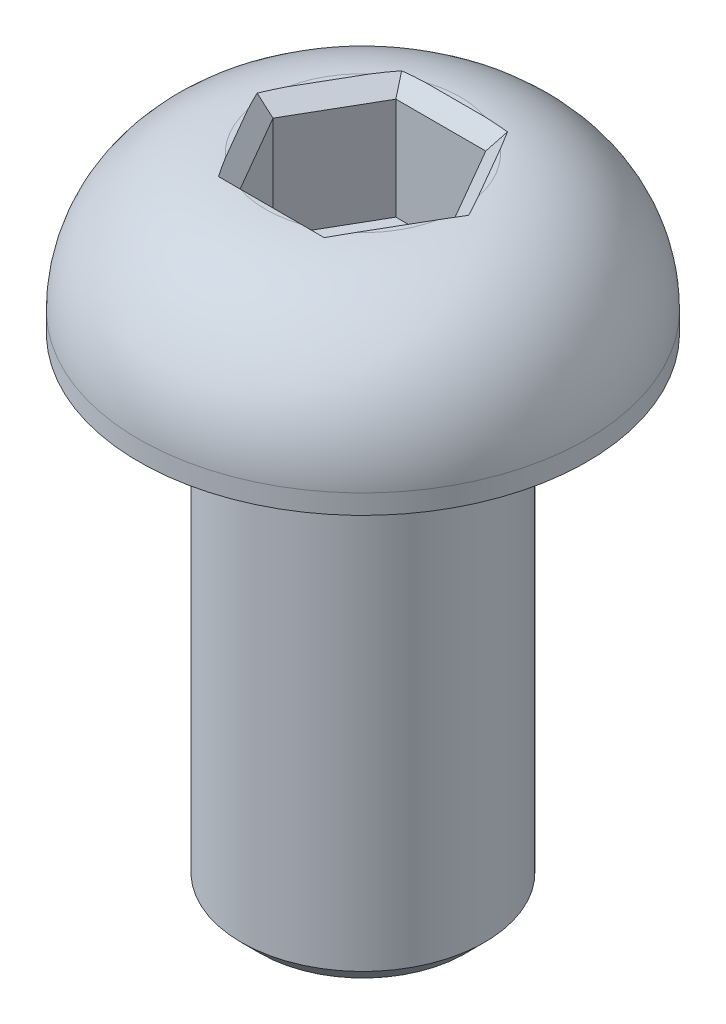
from build123d import *

# Parameters (mm, degrees)
EXTRUDE1_DEPTH = 3.0477
CHAMFER1_SIZE  = 0.381
CHAMFER2_SIZE  = 0.381
CHAMFER3_SIZE  = 0.508


with BuildPart() as part:
    # Sketch1 → Revolve1 (revolve)
    with BuildSketch(Plane.XY, mode=Mode.PRIVATE) as revolve1_sk:
        with BuildLine():
            Line((0, 16.754916971), (-2.54, 16.754916971))
            ThreePointArc((-2.54, 16.754916971), (-4.888725495, 15.631005572), (-5.842, 13.208))
            Line((-5.842, 13.208), (-5.842, 12.7))
            Line((-5.842, 12.7), (-3.175, 12.7))
            Line((-3.175, 12.7), (-3.175, 0))
            Line((-3.175, 0), (0, 0))
            Line((0, 0), (0, 16.754916971))
        make_face()
    revolve(revolve1_sk.sketch.rotate(Axis((0, 0, 0), (0, 1, 0)), 270), axis=Axis((0, 0, 0), (0, 1, 0)))

    # Sketch2 → Extrude1 (cut)
    with BuildSketch(Plane(origin=(0, 16.754916971, 0), x_dir=(1, 0, 0), z_dir=(0, 1, 0))):
        Polygon((1.173175747, -2.032), (2.346351494, 0), (1.173175747, 2.032), (-1.173175747, 2.032), (-2.346351494, 0), (-1.173175747, -2.032), align=None)
    extrude(amount=-EXTRUDE1_DEPTH, mode=Mode.SUBTRACT)

    # Chamfer1
    # the kernel refuses this chamfer: 0.381 mm, written as the material it takes off along each edge
    with BuildSketch(Plane(origin=(2.836257103, 16.754916971, 0.848541406), x_dir=(0.8656979742248802, 0.02749587661058275, -0.4998109584556487), z_dir=(-0.5000000000000003, 0, -0.8660254037844386))) as chamfer1_piece_1_section:
        Polygon((CHAMFER1_SIZE * 0.999621916911, CHAMFER1_SIZE * 0.0274958766106), (-CHAMFER1_SIZE * 0.0274958766106, CHAMFER1_SIZE * 0.999621916911), (0, 0), align=None)
    chamfer1_piece_1 = extrude(amount=4.305973931, mode=Mode.PRIVATE)
    chamfer1_piece_1 = split(chamfer1_piece_1, bisect_by=Plane(origin=(1.86439326, 16.626680536, -2.032), z_dir=(0, 0, 1)), keep=Keep.TOP, mode=Mode.PRIVATE)
    chamfer1_piece_1 = split(chamfer1_piece_1, bisect_by=Plane(origin=(2.691960251, 16.626680536, -0.598611926), z_dir=(-0.8660254037844386, 0, -0.5000000000000002)), keep=Keep.TOP, mode=Mode.PRIVATE)
    add(chamfer1_piece_1, mode=Mode.SUBTRACT)
    with BuildSketch(Plane(origin=(2.152986965, 16.754916971, -2.032), x_dir=(0, 0.027495876610582747, -0.9996219169112968), z_dir=(-1, 0, 0))) as chamfer1_piece_2_section:
        Polygon((CHAMFER1_SIZE * 0.999621916911, CHAMFER1_SIZE * 0.0274958766106), (-CHAMFER1_SIZE * 0.0274958766106, CHAMFER1_SIZE * 0.999621916911), (0, 0), align=None)
    chamfer1_piece_2 = extrude(amount=4.305973931, mode=Mode.PRIVATE)
    chamfer1_piece_2 = split(chamfer1_piece_2, bisect_by=Plane(origin=(-0.82756699, 16.626680536, -2.630611926), z_dir=(0.8660254037844386, 0, 0.5000000000000001)), keep=Keep.TOP, mode=Mode.PRIVATE)
    chamfer1_piece_2 = split(chamfer1_piece_2, bisect_by=Plane(origin=(0.82756699, 16.626680536, -2.630611926), z_dir=(-0.8660254037844387, 0, 0.5000000000000003)), keep=Keep.TOP, mode=Mode.PRIVATE)
    add(chamfer1_piece_2, mode=Mode.SUBTRACT)
    with BuildSketch(Plane(origin=(-0.683270138, 16.754916971, -2.880541406), x_dir=(-0.8656979742248804, 0.02749587661058275, -0.4998109584556485), z_dir=(-0.5000000000000001, 0, 0.8660254037844386))) as chamfer1_piece_3_section:
        Polygon((CHAMFER1_SIZE * 0.999621916911, CHAMFER1_SIZE * 0.0274958766106), (-CHAMFER1_SIZE * 0.0274958766106, CHAMFER1_SIZE * 0.999621916911), (0, 0), align=None)
    chamfer1_piece_3 = extrude(amount=4.305973931, mode=Mode.PRIVATE)
    chamfer1_piece_3 = split(chamfer1_piece_3, bisect_by=Plane(origin=(-2.691960251, 16.626680536, -0.598611926), z_dir=(0.8660254037844387, 0, -0.5000000000000001)), keep=Keep.TOP, mode=Mode.PRIVATE)
    chamfer1_piece_3 = split(chamfer1_piece_3, bisect_by=Plane(origin=(-1.86439326, 16.626680536, -2.032), z_dir=(0, 0, 1)), keep=Keep.TOP, mode=Mode.PRIVATE)
    add(chamfer1_piece_3, mode=Mode.SUBTRACT)
    with BuildSketch(Plane(origin=(2.152986965, 16.754916971, -2.032), x_dir=(0, 0.027495876610582747, -0.9996219169112968), z_dir=(-1, 0, 0))) as chamfer1_piece_4a_section:
        Polygon((CHAMFER1_SIZE * 0.999621916911, CHAMFER1_SIZE * 0.0274958766106), (-CHAMFER1_SIZE * 0.0274958766106, CHAMFER1_SIZE * 0.999621916911), (0, 0), align=None)
    chamfer1_piece_4a = extrude(amount=4.305973931, mode=Mode.PRIVATE)
    chamfer1_piece_4a = split(chamfer1_piece_4a, bisect_by=Plane(origin=(1.229620554, 16.631969248, -1.934234726), z_dir=(0.8660254037844387, 0, -0.5000000000000003)), keep=Keep.TOP, mode=Mode.PRIVATE)
    with BuildSketch(Plane(origin=(2.836257103, 16.754916971, 0.848541406), x_dir=(0.8656979742248802, 0.02749587661058275, -0.4998109584556487), z_dir=(-0.5000000000000003, 0, -0.8660254037844386))) as chamfer1_piece_4b_section:
        Polygon((CHAMFER1_SIZE * 0.999621916911, CHAMFER1_SIZE * 0.0274958766106), (-CHAMFER1_SIZE * 0.0274958766106, CHAMFER1_SIZE * 0.999621916911), (0, 0), align=None)
    chamfer1_piece_4b = extrude(amount=4.305973931, mode=Mode.PRIVATE)
    chamfer1_piece_4b = split(chamfer1_piece_4b, bisect_by=Plane(origin=(1.060286133, 16.631969248, -2.032), z_dir=(0, 0, -1)), keep=Keep.TOP, mode=Mode.PRIVATE)
    chamfer1_piece_4 = chamfer1_piece_4a & chamfer1_piece_4b
    add(chamfer1_piece_4, mode=Mode.SUBTRACT)
    with BuildSketch(Plane(origin=(-0.683270138, 16.754916971, -2.880541406), x_dir=(-0.8656979742248804, 0.02749587661058275, -0.4998109584556485), z_dir=(-0.5000000000000001, 0, 0.8660254037844386))) as chamfer1_piece_5a_section:
        Polygon((CHAMFER1_SIZE * 0.999621916911, CHAMFER1_SIZE * 0.0274958766106), (-CHAMFER1_SIZE * 0.0274958766106, CHAMFER1_SIZE * 0.999621916911), (0, 0), align=None)
    chamfer1_piece_5a = extrude(amount=4.305973931, mode=Mode.PRIVATE)
    chamfer1_piece_5a = split(chamfer1_piece_5a, bisect_by=Plane(origin=(-1.060286133, 16.631969248, -2.032), z_dir=(0, 0, -1)), keep=Keep.TOP, mode=Mode.PRIVATE)
    with BuildSketch(Plane(origin=(2.152986965, 16.754916971, -2.032), x_dir=(0, 0.027495876610582747, -0.9996219169112968), z_dir=(-1, 0, 0))) as chamfer1_piece_5b_section:
        Polygon((CHAMFER1_SIZE * 0.999621916911, CHAMFER1_SIZE * 0.0274958766106), (-CHAMFER1_SIZE * 0.0274958766106, CHAMFER1_SIZE * 0.999621916911), (0, 0), align=None)
    chamfer1_piece_5b = extrude(amount=4.305973931, mode=Mode.PRIVATE)
    chamfer1_piece_5b = split(chamfer1_piece_5b, bisect_by=Plane(origin=(-1.229620554, 16.631969248, -1.934234726), z_dir=(-0.8660254037844386, 0, -0.5000000000000001)), keep=Keep.TOP, mode=Mode.PRIVATE)
    chamfer1_piece_5 = chamfer1_piece_5a & chamfer1_piece_5b
    add(chamfer1_piece_5, mode=Mode.SUBTRACT)

    # Chamfer2
    # the kernel refuses this chamfer: 0.381 mm, written as the material it takes off along each edge
    with BuildSketch(Plane(origin=(3.01166923, 16.754916971, -1.152364121), x_dir=(-0.02381212764409397, -0.9996219169112966, -0.013747938305285933), z_dir=(-0.4999999999999081, 5.2687907827436646e-15, 0.8660254037844918))) as chamfer2_piece_1_section:
        Polygon((CHAMFER2_SIZE * 0.999621916911, CHAMFER2_SIZE * 0.0274958766106), (-CHAMFER2_SIZE * 0.0274958766106, CHAMFER2_SIZE * 0.999621916911), (0, 0), align=None)
    chamfer2_piece_1 = extrude(amount=4.656798184, mode=Mode.PRIVATE)
    chamfer2_piece_1 = split(chamfer2_piece_1, bisect_by=Plane(origin=(2.577265725, 16.592496514, -0.037203907), z_dir=(-0.6123724356959522, 0.7071067811862759, 0.35355339059354396)), keep=Keep.TOP, mode=Mode.PRIVATE)
    chamfer2_piece_1 = split(chamfer2_piece_1, bisect_by=Plane(origin=(2.387970288, 16.665356362, 0.072085865), z_dir=(0.8660254037844386, 0, -0.5000000000000003)), keep=Keep.TOP, mode=Mode.PRIVATE)
    add(chamfer2_piece_1, mode=Mode.SUBTRACT)
    with BuildSketch(Plane(origin=(3.01166923, 16.754916971, -1.152364121), x_dir=(-0.02381212764409397, -0.9996219169112966, -0.013747938305285933), z_dir=(-0.4999999999999081, 5.2687907827436646e-15, 0.8660254037844918))) as chamfer2_piece_2_section:
        Polygon((CHAMFER2_SIZE * 0.999621916911, CHAMFER2_SIZE * 0.0274958766106), (-CHAMFER2_SIZE * 0.0274958766106, CHAMFER2_SIZE * 0.999621916911), (0, 0), align=None)
    chamfer2_piece_2 = extrude(amount=4.656798184, mode=Mode.PRIVATE)
    chamfer2_piece_2 = split(chamfer2_piece_2, bisect_by=Plane(origin=(2.691961715, 16.626681616, 0.598614463), z_dir=(-0.8660254037844386, 0, 0.5000000000000003)), keep=Keep.TOP, mode=Mode.PRIVATE)
    chamfer2_piece_2 = split(chamfer2_piece_2, bisect_by=Plane(origin=(1.864391291, 16.626681616, 2.032), z_dir=(0, 0, -1)), keep=Keep.TOP, mode=Mode.PRIVATE)
    add(chamfer2_piece_2, mode=Mode.SUBTRACT)
    with BuildSketch(Plane(origin=(-2.152986965, 16.754916971, 2.032), x_dir=(0, 0.027495876610582747, 0.9996219169112968), z_dir=(1, 0, 0))) as chamfer2_piece_3_section:
        Polygon((CHAMFER2_SIZE * 0.999621916911, CHAMFER2_SIZE * 0.0274958766106), (-CHAMFER2_SIZE * 0.0274958766106, CHAMFER2_SIZE * 0.999621916911), (0, 0), align=None)
    chamfer2_piece_3 = extrude(amount=4.305973931, mode=Mode.PRIVATE)
    chamfer2_piece_3 = split(chamfer2_piece_3, bisect_by=Plane(origin=(0.82756699, 16.626680536, 2.630611926), z_dir=(-0.866025403784329, 0, -0.50000000000019)), keep=Keep.TOP, mode=Mode.PRIVATE)
    chamfer2_piece_3 = split(chamfer2_piece_3, bisect_by=Plane(origin=(-0.82756699, 16.626680536, 2.630611926), z_dir=(0.866025403784329, 0, -0.50000000000019)), keep=Keep.TOP, mode=Mode.PRIVATE)
    add(chamfer2_piece_3, mode=Mode.SUBTRACT)
    with BuildSketch(Plane(origin=(-0.683270138, 16.754916971, 2.880541406), x_dir=(-0.8656979742249333, 0.02749587661058274, 0.4998109584555566), z_dir=(-0.49999999999990835, -5.268790782743671e-15, -0.8660254037844917))) as chamfer2_piece_4_section:
        Polygon((CHAMFER2_SIZE * 0.999621916911, -CHAMFER2_SIZE * 0.0274958766106), (-CHAMFER2_SIZE * 0.0274958766106, -CHAMFER2_SIZE * 0.999621916911), (0, 0), align=None)
    chamfer2_piece_4 = extrude(amount=4.656798184, mode=Mode.PRIVATE)
    chamfer2_piece_4 = split(chamfer2_piece_4, bisect_by=Plane(origin=(-1.864391291, 16.626681616, 2.032), z_dir=(0, 0, -1)), keep=Keep.TOP, mode=Mode.PRIVATE)
    chamfer2_piece_4 = split(chamfer2_piece_4, bisect_by=Plane(origin=(-2.691961715, 16.626681616, 0.598614463), z_dir=(0.866025403784329, 0, 0.50000000000019)), keep=Keep.TOP, mode=Mode.PRIVATE)
    add(chamfer2_piece_4, mode=Mode.SUBTRACT)
    with BuildSketch(Plane(origin=(-0.683270138, 16.754916971, 2.880541406), x_dir=(-0.8656979742249333, 0.02749587661058274, 0.4998109584555566), z_dir=(-0.49999999999990835, -5.268790782743671e-15, -0.8660254037844917))) as chamfer2_piece_5_section:
        Polygon((CHAMFER2_SIZE * 0.999621916911, -CHAMFER2_SIZE * 0.0274958766106), (-CHAMFER2_SIZE * 0.0274958766106, -CHAMFER2_SIZE * 0.999621916911), (0, 0), align=None)
    chamfer2_piece_5 = extrude(amount=4.656798184, mode=Mode.PRIVATE)
    chamfer2_piece_5 = split(chamfer2_piece_5, bisect_by=Plane(origin=(-2.387970288, 16.665356362, 0.072085865), z_dir=(-0.866025403784329, 0, -0.50000000000019)), keep=Keep.TOP, mode=Mode.PRIVATE)
    chamfer2_piece_5 = split(chamfer2_piece_5, bisect_by=Plane(origin=(-2.577265725, 16.592496514, -0.037203907), z_dir=(0.6123724356959522, 0.7071067811862759, 0.35355339059354396)), keep=Keep.TOP, mode=Mode.PRIVATE)
    add(chamfer2_piece_5, mode=Mode.SUBTRACT)
    with BuildSketch(Plane(origin=(3.01166923, 16.754916971, -1.152364121), x_dir=(-0.02381212764409397, -0.9996219169112966, -0.013747938305285933), z_dir=(-0.4999999999999081, 5.2687907827436646e-15, 0.8660254037844918))) as chamfer2_piece_6a_section:
        Polygon((CHAMFER2_SIZE * 0.999621916911, CHAMFER2_SIZE * 0.0274958766106), (-CHAMFER2_SIZE * 0.0274958766106, CHAMFER2_SIZE * 0.999621916911), (0, 0), align=None)
    chamfer2_piece_6a = extrude(amount=4.656798184, mode=Mode.PRIVATE)
    chamfer2_piece_6a = split(chamfer2_piece_6a, bisect_by=Plane(origin=(1.060286133, 16.631969248, 2.032), z_dir=(0, 0, 1)), keep=Keep.TOP, mode=Mode.PRIVATE)
    with BuildSketch(Plane(origin=(-2.152986965, 16.754916971, 2.032), x_dir=(0, 0.027495876610582747, 0.9996219169112968), z_dir=(1, 0, 0))) as chamfer2_piece_6b_section:
        Polygon((CHAMFER2_SIZE * 0.999621916911, CHAMFER2_SIZE * 0.0274958766106), (-CHAMFER2_SIZE * 0.0274958766106, CHAMFER2_SIZE * 0.999621916911), (0, 0), align=None)
    chamfer2_piece_6b = extrude(amount=4.305973931, mode=Mode.PRIVATE)
    chamfer2_piece_6b = split(chamfer2_piece_6b, bisect_by=Plane(origin=(1.229620554, 16.631969248, 1.934234726), z_dir=(0.866025403784329, 0, 0.50000000000019)), keep=Keep.TOP, mode=Mode.PRIVATE)
    chamfer2_piece_6 = chamfer2_piece_6a & chamfer2_piece_6b
    add(chamfer2_piece_6, mode=Mode.SUBTRACT)
    with BuildSketch(Plane(origin=(-0.683270138, 16.754916971, 2.880541406), x_dir=(-0.8656979742249333, 0.02749587661058274, 0.4998109584555566), z_dir=(-0.49999999999990835, -5.268790782743671e-15, -0.8660254037844917))) as chamfer2_piece_7a_section:
        Polygon((CHAMFER2_SIZE * 0.999621916911, -CHAMFER2_SIZE * 0.0274958766106), (-CHAMFER2_SIZE * 0.0274958766106, -CHAMFER2_SIZE * 0.999621916911), (0, 0), align=None)
    chamfer2_piece_7a = extrude(amount=4.656798184, mode=Mode.PRIVATE)
    chamfer2_piece_7a = split(chamfer2_piece_7a, bisect_by=Plane(origin=(-1.060286133, 16.631969248, 2.032), z_dir=(0, 0, 1)), keep=Keep.TOP, mode=Mode.PRIVATE)
    with BuildSketch(Plane(origin=(-2.152986965, 16.754916971, 2.032), x_dir=(0, 0.027495876610582747, 0.9996219169112968), z_dir=(1, 0, 0))) as chamfer2_piece_7b_section:
        Polygon((CHAMFER2_SIZE * 0.999621916911, CHAMFER2_SIZE * 0.0274958766106), (-CHAMFER2_SIZE * 0.0274958766106, CHAMFER2_SIZE * 0.999621916911), (0, 0), align=None)
    chamfer2_piece_7b = extrude(amount=4.305973931, mode=Mode.PRIVATE)
    chamfer2_piece_7b = split(chamfer2_piece_7b, bisect_by=Plane(origin=(-1.229620554, 16.631969248, 1.934234726), z_dir=(-0.866025403784329, 0, 0.50000000000019)), keep=Keep.TOP, mode=Mode.PRIVATE)
    chamfer2_piece_7 = chamfer2_piece_7a & chamfer2_piece_7b
    add(chamfer2_piece_7, mode=Mode.SUBTRACT)

    # Chamfer3
    chamfer3_edges = [part.edges().sort_by_distance(p)[0] for p in [
        (0, 0, 3.175),
    ]]
    chamfer(chamfer3_edges, length=CHAMFER3_SIZE)


solid = part.part
